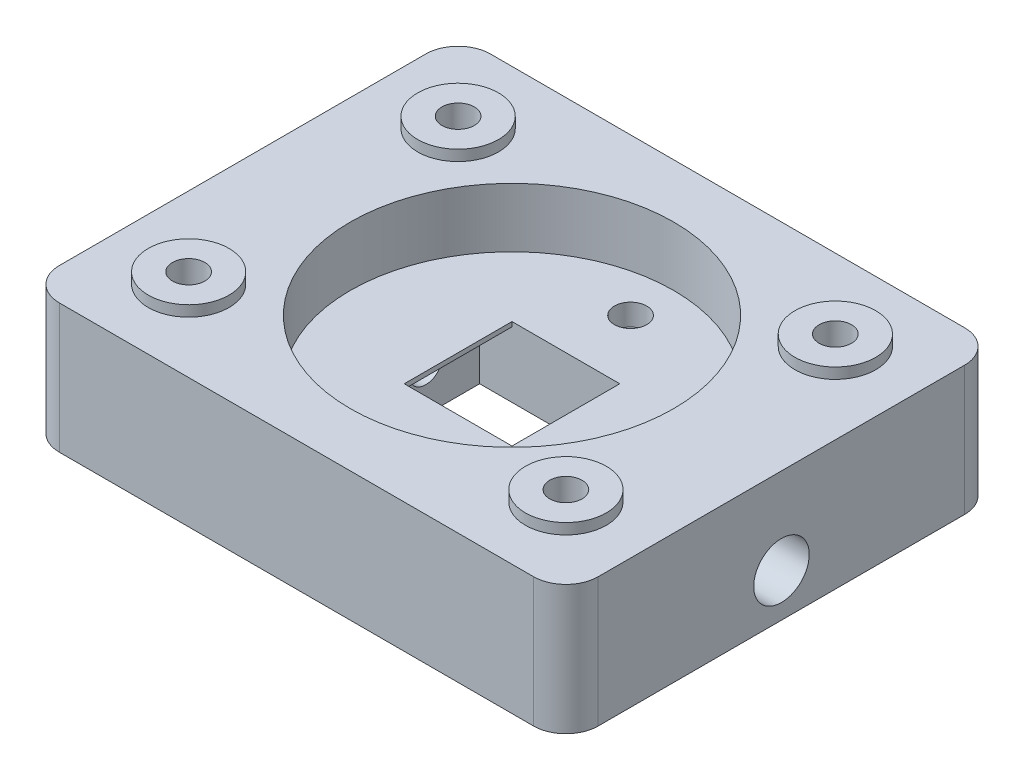
from build123d import *
from OCP.BRepFilletAPI import BRepFilletAPI_MakeChamfer

# Parameters (mm, degrees)
SKETCH1_W           = 50
SKETCH1_H           = 40
BODY_DEPTH          = 12
FILLETBODY_R        = 3
SKETCH3_R           = 3.75
BOLT_EXTRUDE_DEPTH  = 1
BOLT_DEPTH          = 10
BOLT_DEPTH_BACK     = 16
SKETCH4_R           = 1.5
SKETCH41_R          = 1.575
CHANNEL1_DEPTH      = 57
SKETCH42_R          = 2.575
INLET_DEPTH         = 5
OUTLET_START        = -5
SKETCH43_R          = 2.575
OUTLET_DEPTH        = 5
SKETCH44_R          = 15
WINDOW_DEPTH        = 5.5
SKETCH45_W          = 16
SKETCH45_H          = 10
FLOWCH_DEPTH        = 5.575
SKETCH46_W          = 10
SKETCH46_H          = 10
WINDOW_HOLE_DEPTH   = 16
SKETCH49_R          = 1.5
FIXHOLES_DEPTH      = 2
GASKET_DEPTH        = 1
CHAMFER_FLOW_SIZE   = 0.5
CHAMFER_FLOW_SIZE_2 = 3


with BuildPart() as part:
    # Sketch1 → Body (new body)
    with BuildSketch(Plane(origin=(0, 0, 0), x_dir=(1, 0, 0), z_dir=(0, 1, 0))):
        Rectangle(SKETCH1_W, SKETCH1_H)
    extrude(amount=BODY_DEPTH)

    # FilletBody
    filletbody_edges = [part.edges().sort_by_distance(p)[0] for p in [
        (-25, 6, -20),
        (25, 6, -20),
        (25, 6, 20),
        (-25, 6, 20),
    ]]
    fillet(filletbody_edges, radius=FILLETBODY_R)

    # Sketch3 → Bolt extrude (add)
    with BuildSketch(Plane(origin=(0, 12, 0), x_dir=(1, 0, 0), z_dir=(0, 1, 0))):
        with Locations(Location((-17.5, 12.5, 0), (0, 0, 270))):
            Circle(SKETCH3_R)
        with Locations(Location((17.5, 12.5, 0), (0, 0, 90))):
            Circle(SKETCH3_R)
        with Locations(Location((17.5, -12.5, 0), (0, 0, 270))):
            Circle(SKETCH3_R)
        with Locations(Location((-17.5, -12.5, 0), (0, 0, 90))):
            Circle(SKETCH3_R)
    extrude(amount=BOLT_EXTRUDE_DEPTH)

    # Sketch4 → Bolt (cut, two sides: drawn at the far end of the back side and taken through both)
    with BuildSketch(Plane(origin=(0, 13, 0), x_dir=(1, 0, 0), z_dir=(0, 1, 0)).offset(-BOLT_DEPTH_BACK)):
        with Locations(Location((-17.5, 12.5, 0), (0, 0, 270))):
            Circle(SKETCH4_R)
        with Locations(Location((17.5, 12.5, 0), (0, 0, 90))):
            Circle(SKETCH4_R)
        with Locations(Location((17.5, -12.5, 0), (0, 0, 270))):
            Circle(SKETCH4_R)
        with Locations(Location((-17.5, -12.5, 0), (0, 0, 90))):
            Circle(SKETCH4_R)
    extrude(amount=BOLT_DEPTH + BOLT_DEPTH_BACK, mode=Mode.SUBTRACT)

    # Sketch41 → Channel1 (cut)
    with BuildSketch(Plane.ZY.offset(25)):
        with Locations((0, 4)):
            Circle(SKETCH41_R)
    extrude(amount=-CHANNEL1_DEPTH, mode=Mode.SUBTRACT)

    # Sketch42 → Inlet (cut)
    with BuildSketch(Plane.ZY.offset(25)):
        with Locations((0, 4)):
            Circle(SKETCH42_R)
    extrude(amount=-INLET_DEPTH, mode=Mode.SUBTRACT)

    # Sketch43 → Outlet (cut)
    with BuildSketch(Plane(origin=(25, 0, 0), x_dir=(0, 0, -1), z_dir=(1, 0, 0)).offset(OUTLET_START)):
        with Locations(Location((0, 4, 0), (0, 0, 180))):
            Circle(SKETCH43_R)
    extrude(amount=OUTLET_DEPTH, mode=Mode.SUBTRACT)

    # Sketch44 → Window (cut)
    with BuildSketch(Plane(origin=(0, 12, 0), x_dir=(1, 0, 0), z_dir=(0, 1, 0))):
        with Locations(Location((0, 0, 0), (0, 0, 270))):
            Circle(SKETCH44_R)
    extrude(amount=-WINDOW_DEPTH, mode=Mode.SUBTRACT)

    # Sketch45 → FlowCh (cut)
    with BuildSketch(Plane.XZ):
        Rectangle(SKETCH45_W, SKETCH45_H)
    extrude(amount=-FLOWCH_DEPTH, mode=Mode.SUBTRACT)

    # Sketch46 → Window_hole (cut)
    with BuildSketch(Plane(origin=(0, 6.5, 0), x_dir=(1, 0, 0), z_dir=(0, 1, 0))):
        Rectangle(SKETCH46_W, SKETCH46_H)
    extrude(amount=-WINDOW_HOLE_DEPTH, mode=Mode.SUBTRACT)

    # Sketch49 → FixHoles (cut)
    with BuildSketch(Plane(origin=(0, 6.5, 0), x_dir=(1, 0, 0), z_dir=(0, 1, 0))):
        with Locations(Location((0, 11, 0), (0, 0, 270))):
            Circle(SKETCH49_R)
        with Locations(Location((0, -11, 0), (0, 0, 270))):
            Circle(SKETCH49_R)
    extrude(amount=-FIXHOLES_DEPTH, mode=Mode.SUBTRACT)

    # Sketch50 → Gasket (cut)
    with BuildSketch(Plane.XZ):
        with BuildLine():
            ThreePointArc((8, 11), (12.242640687, 9.242640687), (14, 5))
            Line((14, 5), (14, -5))
            ThreePointArc((14, -5), (12.242640687, -9.242640687), (8, -11))
            Line((8, -11), (-8, -11))
            ThreePointArc((-8, -11), (-12.242640687, -9.242640687), (-14, -5))
            Line((-14, -5), (-14, 5))
            ThreePointArc((-14, 5), (-12.242640687, 9.242640687), (-8, 11))
            Line((-8, 11), (8, 11))
        make_face()
        with BuildLine():
            Line((-8, -7), (8, -7))
            ThreePointArc((8, -7), (9.414213562, -6.414213562), (10, -5))
            Line((10, -5), (10, 5))
            ThreePointArc((10, 5), (9.414213562, 6.414213562), (8, 7))
            Line((8, 7), (-8, 7))
            ThreePointArc((-8, 7), (-9.414213562, 6.414213562), (-10, 5))
            Line((-10, 5), (-10, -5))
            ThreePointArc((-10, -5), (-9.414213562, -6.414213562), (-8, -7))
        make_face(mode=Mode.SUBTRACT)
    extrude(amount=-GASKET_DEPTH, mode=Mode.SUBTRACT)

    # Chamfer_flow
    chamfer_flow_edges_1 = [part.edges().sort_by_distance(p)[0] for p in [
        (5, 5.575, 0),
    ]]
    chamfer_flow_side_1 = [part.faces().sort_by_distance(p)[0] for p in [
        (5, 5.585, 0),
    ]]
    chamfer_flow_edges_2 = [part.edges().sort_by_distance(p)[0] for p in [
        (-5, 5.575, 0),
    ]]
    chamfer_flow_side_2 = [part.faces().sort_by_distance(p)[0] for p in [
        (-5, 5.585, 0),
    ]]
    chamfer_flow = BRepFilletAPI_MakeChamfer(part.part.solid().wrapped)
    for e in chamfer_flow_edges_1:
        chamfer_flow.Add(CHAMFER_FLOW_SIZE - 0.0001, CHAMFER_FLOW_SIZE_2 - 0.0001, e.wrapped, chamfer_flow_side_1[0].wrapped)
    for e in chamfer_flow_edges_2:
        chamfer_flow.Add(CHAMFER_FLOW_SIZE - 0.0001, CHAMFER_FLOW_SIZE_2 - 0.0001, e.wrapped, chamfer_flow_side_2[0].wrapped)
    add(Compound.cast(chamfer_flow.Shape()), mode=Mode.REPLACE)  # a hair under: the kernel refuses the full size


solid = part.part
